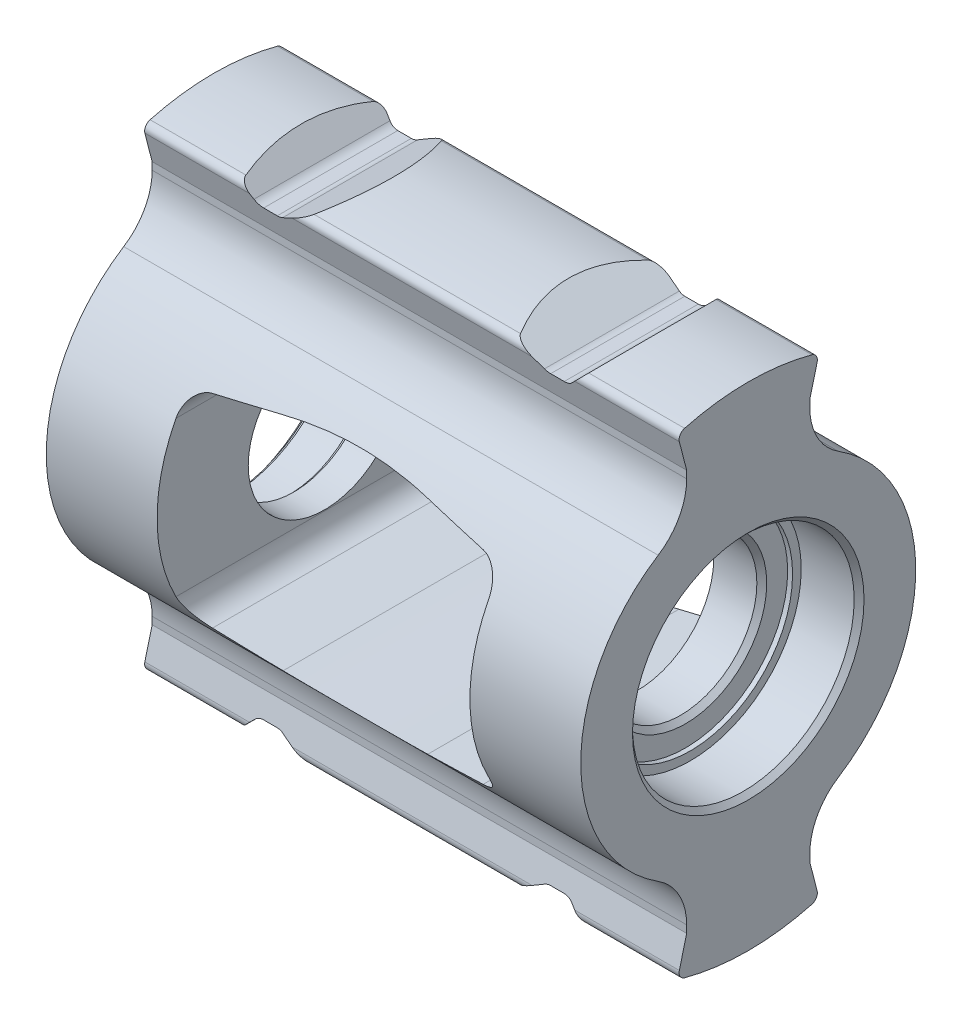
from build123d import *

# Parameters (mm, degrees)
EXTRUDE_1_DEPTH          = 217
CUT_EXTRUDE_1_DEPTH      = 249.421013604
CUT_EXTRUDE_1_DEPTH_BACK = 249.421013604
CUT_EXTRUDE_2_DEPTH      = 249.421013719
CUT_EXTRUDE_2_DEPTH_BACK = 28.5
SKETCH_4_R               = 45
CUT_EXTRUDE_START        = -23.5
SKETCH_6_R               = 45
CUT_EXTRUDE_3_DEPTH      = 23.5
PATTERN_CIRCULAR_1_COUNT = 6
SKETCH_11_R              = 41.5
CUT_EXTRUDE_4_DEPTH      = 2
CUT_EXTRUDE_START_2      = -2
SKETCH_12_R              = 41.5
CUT_EXTRUDE_5_DEPTH      = 2
FILLET_1_R               = 5
FILLET_3_R               = 10
SKETCH_13_R              = 51.5
SKETCH_13_R_2            = 45
CUT_EXTRUDE_6_DEPTH      = 5
CHAMFER_1_SIZE           = 2
FILLET_5_R               = 3


with BuildPart() as part:
    # Эскиз1 → Бобышка-Вытянуть1 (new body)
    with BuildSketch(Plane(origin=(0, 0, 0), x_dir=(0, 0, -1), z_dir=(1, 0, 0))):
        with BuildLine():
            Line((-25, 81.41555968), (-25, 78.41555968))
            ThreePointArc((-25, 78.41555968), (-28.079444517, 66.395191661), (-36.559139785, 57.336108153))
            ThreePointArc((-36.559139785, 57.336108153), (-68, 0), (-36.559139785, -57.336108153))
            ThreePointArc((-36.559139785, -57.336108153), (-28.079444517, -66.395191661), (-25, -78.41555968))
            Line((-25, -78.41555968), (-25, -81.41555968))
            Line((-25, -81.41555968), (-28.711374095, -95.789649741))
            ThreePointArc((-28.711374095, -95.789649741), (0, -100), (28.711374095, -95.789649741))
            Line((28.711374095, -95.789649741), (25, -81.41555968))
            Line((25, -81.41555968), (25, -78.41555968))
            ThreePointArc((25, -78.41555968), (28.079444517, -66.395191661), (36.559139785, -57.336108153))
            ThreePointArc((36.559139785, -57.336108153), (68, 0), (36.559139785, 57.336108153))
            ThreePointArc((36.559139785, 57.336108153), (28.079444517, 66.395191661), (25, 78.41555968))
            Line((25, 78.41555968), (25, 81.41555968))
            Line((25, 81.41555968), (28.711374095, 95.789649741))
            ThreePointArc((28.711374095, 95.789649741), (0, 100), (-28.711374095, 95.789649741))
            Line((-28.711374095, 95.789649741), (-25, 81.41555968))
        make_face()
        with BuildLine():
            ThreePointArc((25, 18.33030278), (29.461839725, 9.643650761), (31, 0))
            ThreePointArc((31, 0), (-9.643650761, -29.461839725), (-25, 18.33030278))
            ThreePointArc((-25, 18.33030278), (0, 31), (25, 18.33030278))
        make_face(mode=Mode.SUBTRACT)
    extrude(amount=EXTRUDE_1_DEPTH)

    # Эскиз2 → Вырез-Вытянуть1 (cut, two sides: drawn at the far end of the back side and taken through both)
    with BuildSketch(Plane.XY.offset(-CUT_EXTRUDE_1_DEPTH_BACK)):
        with BuildLine():
            Line((45, 40), (79.144116191, 45))
            ThreePointArc((79.144116191, 45), (108.5, 47.166150303), (137.855883809, 45))
            Line((137.855883809, 45), (172, 40))
            Line((172, 40), (172, -40))
            Line((172, -40), (137.855883809, -45))
            ThreePointArc((137.855883809, -45), (108.5, -47.166150303), (79.144116191, -45))
            Line((79.144116191, -45), (45, -40))
            Line((45, -40), (45, 40))
        make_face()
        Polygon((35.55, 100), (72.95, 100), (54.25, 90), (45.4, 90), align=None)
        Polygon((162.75, 90), (171.6, 90), (181.45, 100), (144.05, 100), align=None)
        Polygon((162.75, -90), (144.05, -100), (181.45, -100), (171.6, -90), align=None)
        Polygon((54.25, -90), (72.95, -100), (35.55, -100), (45.4, -90), align=None)
    extrude(amount=CUT_EXTRUDE_1_DEPTH + CUT_EXTRUDE_1_DEPTH_BACK, mode=Mode.SUBTRACT)

    # Эскиз4 → Вырез-Вытянуть2 (cut, two sides: drawn at the far end of the back side and taken through both)
    with BuildSketch(Plane.ZY.offset(-CUT_EXTRUDE_2_DEPTH_BACK)):
        with Locations(Location((0, 0, 0), (0, 0, 180))):
            Circle(SKETCH_4_R)
    extrude(amount=CUT_EXTRUDE_2_DEPTH + CUT_EXTRUDE_2_DEPTH_BACK, mode=Mode.SUBTRACT)

    # Эскиз6 → Вырез-Вытянуть3 (cut)
    with BuildSketch(Plane(origin=(217, 0, 0), x_dir=(0, 0, -1), z_dir=(1, 0, 0)).offset(CUT_EXTRUDE_START)):
        Circle(SKETCH_6_R)
    extrude(amount=CUT_EXTRUDE_3_DEPTH, mode=Mode.SUBTRACT)

    # Эскиз8 → Отверстие обработанное метчиком M81 (revolve, cut)
    with BuildSketch(Plane.ZX.offset(57.5)):
        Polygon((0, 0), (0, 34.042926105), (3.4, 32), (3.4, 0.625), (4.025, 0), align=None)
    hole_wizard_m81 = revolve(axis=Axis((-6.35, 57.5, 0), (1, 0, 0)), mode=Mode.SUBTRACT)

    # Круговой массив1: Отверстие обработанное метчиком M81 ×6 about axis
    pattern_circular_1_axis = Axis((0, 0, 0), (1, 0, 0))
    for i in range(1, PATTERN_CIRCULAR_1_COUNT):
        add(hole_wizard_m81.rotate(pattern_circular_1_axis, i * 360 / PATTERN_CIRCULAR_1_COUNT), mode=Mode.SUBTRACT)

    # Эскиз11 → Вырез-Вытянуть4 (cut)
    with BuildSketch(Plane.ZY.offset(-28.5)):
        Circle(SKETCH_11_R)
    extrude(amount=-CUT_EXTRUDE_4_DEPTH, mode=Mode.SUBTRACT)

    # Эскиз12 → Вырез-Вытянуть5 (cut)
    with BuildSketch(Plane(origin=(193.5, 0, 0), x_dir=(0, 0, -1), z_dir=(1, 0, 0)).offset(CUT_EXTRUDE_START_2)):
        with Locations(Location((0, 0, 0), (0, 0, 180))):
            Circle(SKETCH_12_R)
    extrude(amount=CUT_EXTRUDE_5_DEPTH, mode=Mode.SUBTRACT)

    # Скругление1
    fillet_1_edges = [part.edges().sort_by_distance(p)[0] for p in [
        (171.6, -90, 0),
        (162.75, 90, 0),
        (171.6, 90, 0),
        (54.25, 90, 0),
        (45.4, 90, 0),
        (45.4, -90, 0),
        (54.25, -90, 0),
        (162.75, -90, 0),
    ]]
    fillet(fillet_1_edges, radius=FILLET_1_R)

    # Скругление3
    fillet_3_edges = [part.edges().sort_by_distance(p)[0] for p in [
        (45, 40, 0),
        (172, 40, 0),
        (45, -40, 0),
        (172, -40, 0),
    ]]
    fillet(fillet_3_edges, radius=FILLET_3_R)

    # Эскиз13 → Вырез-Вытянуть6 (cut)
    with BuildSketch(Plane.ZY):
        Circle(SKETCH_13_R)
        with Locations(Location((0, 0, 0), (0, 0, 180))):
            Circle(SKETCH_13_R_2, mode=Mode.SUBTRACT)
    extrude(amount=-CUT_EXTRUDE_6_DEPTH, mode=Mode.SUBTRACT)

    # Фаска1
    # the kernel refuses this chamfer: 2 mm, written as the material it takes off along each edge
    with BuildSketch(Plane(origin=(217, 0, 0), x_dir=(0, 0, -1), z_dir=(0, -1, 0))) as chamfer_1_piece_1:
        Polygon((45 + CHAMFER_1_SIZE, 0), (45, -CHAMFER_1_SIZE), (45, 0), align=None)
    revolve(axis=Axis((217, 0, 0), (1, 0, 0)), mode=Mode.SUBTRACT)
    with BuildSketch(Plane(origin=(30.5, 0, 0), x_dir=(0, 0.591300089671721, 0.806451612903226), z_dir=(0, -0.806451612903226, 0.591300089671721))) as chamfer_1_piece_2:
        Polygon((31, -CHAMFER_1_SIZE), (31 + CHAMFER_1_SIZE, 0), (31, 0), align=None)
    revolve(axis=Axis((30.5, 0, 0), (-1, 0, 0)), mode=Mode.SUBTRACT)
    with BuildSketch(Plane(origin=(191.5, 0, 0), x_dir=(0, 0.591300089671721, 0.806451612903226), z_dir=(0, -0.806451612903226, 0.591300089671721))) as chamfer_1_piece_3:
        Polygon((31, CHAMFER_1_SIZE), (31 + CHAMFER_1_SIZE, 0), (31, 0), align=None)
    revolve(axis=Axis((191.5, 0, 0), (-1, 0, 0)), mode=Mode.SUBTRACT)
    with BuildSketch(Plane(origin=(5, 0, 0), x_dir=(0, 0, -1), z_dir=(0, 1, 0))) as chamfer_1_piece_4:
        Polygon((45 + CHAMFER_1_SIZE, 0), (45, -CHAMFER_1_SIZE), (45, 0), align=None)
    revolve(axis=Axis((5, 0, 0), (-1, 0, 0)), mode=Mode.SUBTRACT)
    with BuildSketch(Plane(origin=(0, 0, 0), x_dir=(0, 0, 1), z_dir=(0, -1, 0))) as chamfer_1_piece_5:
        Polygon((51.5 + CHAMFER_1_SIZE, 0), (51.5, -CHAMFER_1_SIZE), (51.5, 0), align=None)
    revolve(axis=Axis((0, 0, 0), (-1, 0, 0)), mode=Mode.SUBTRACT)

    # Скругление5
    fillet_5_edges = [part.edges().sort_by_distance(p)[0] for p in [
        (19.848597502, -95.789649741, 28.711374095),
        (108.5, -95.789649741, 28.711374095),
        (197.151402498, -95.789649741, 28.711374095),
        (19.848597502, -95.789649741, -28.711374095),
        (108.5, -95.789649741, -28.711374095),
        (197.151402498, -95.789649741, -28.711374095),
        (19.848597502, 95.789649741, 28.711374095),
        (108.5, 95.789649741, 28.711374095),
        (197.151402498, 95.789649741, 28.711374095),
        (19.848597502, 95.789649741, -28.711374095),
        (108.5, 95.789649741, -28.711374095),
        (197.151402498, 95.789649741, -28.711374095),
    ]]
    fillet(fillet_5_edges, radius=FILLET_5_R)


solid = part.part
